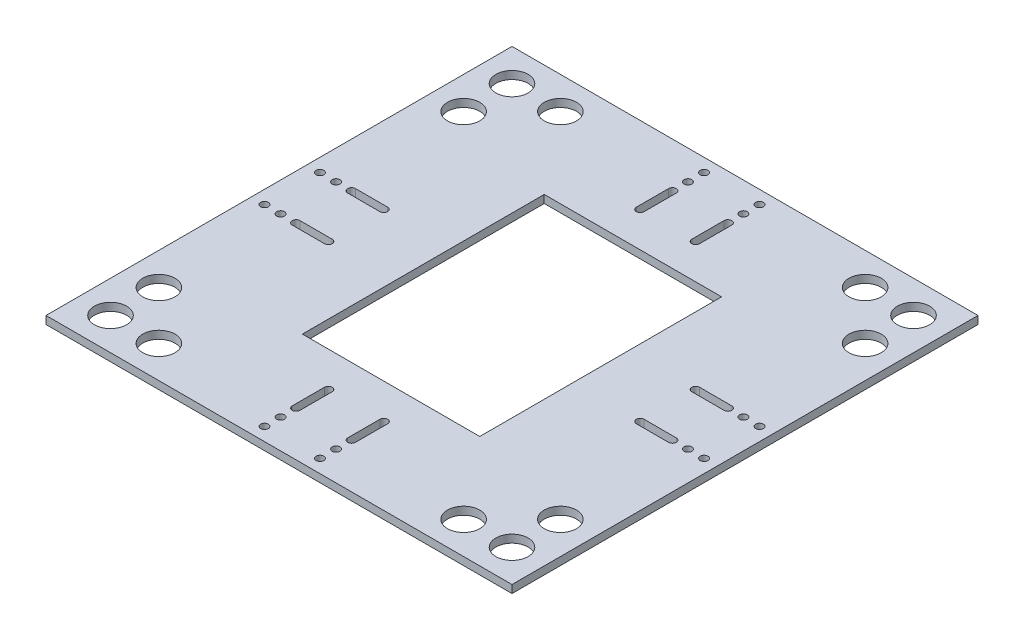
from build123d import *

# Parameters (mm, degrees)
SKETCH3_W           = 183.5200292
SKETCH3_H           = 183.5200292
BOSS_EXTRUDE1_DEPTH = 3.0988
SKETCH4_R           = 1.524
CUT_EXTRUDE1_DEPTH  = 260.555013045
CUT_EXTRUDE2_REACH  = 261.555
SKETCH5_R           = 6.35
SKETCH5_W           = 69.85
SKETCH5_H           = 95.25


with BuildPart() as part:
    # Sketch3 → Boss-Extrude1 (new body)
    with BuildSketch(Plane(origin=(0, 0, 0), x_dir=(1, 0, 0), z_dir=(0, 1, 0))):
        with Locations((91.7600146, 91.7600146)):
            Rectangle(SKETCH3_W, SKETCH3_H)
    extrude(amount=BOSS_EXTRUDE1_DEPTH)

    # Sketch4 → Cut-Extrude1 (cut, through all)
    with BuildSketch(Plane(origin=(0, 3.0988, 0), x_dir=(1, 0, 0), z_dir=(0, 1, 0))):
        with Locations((5.200015, 102.6820146)):
            Circle(SKETCH4_R)
        with Locations((11.550015, 102.6820146)):
            Circle(SKETCH4_R)
        with Locations((11.550015, 80.8380146)):
            Circle(SKETCH4_R)
        with Locations((5.200015, 80.8380146)):
            Circle(SKETCH4_R)
        with Locations((178.3200142, 80.8380146)):
            Circle(SKETCH4_R)
        with Locations((171.9700142, 80.8380146)):
            Circle(SKETCH4_R)
        with Locations((171.9700142, 102.6820146)):
            Circle(SKETCH4_R)
        with Locations((178.3200142, 102.6820146)):
            Circle(SKETCH4_R)
        with Locations((80.8380146, 178.3130292)):
            Circle(SKETCH4_R)
        with Locations((80.8380146, 171.9630292)):
            Circle(SKETCH4_R)
        with Locations((102.6820146, 171.9630292)):
            Circle(SKETCH4_R)
        with Locations((102.6820146, 178.3130292)):
            Circle(SKETCH4_R)
        with Locations((102.6820146, 5.207)):
            Circle(SKETCH4_R)
        with Locations((102.6820146, 11.557)):
            Circle(SKETCH4_R)
        with Locations((80.8380146, 11.557)):
            Circle(SKETCH4_R)
        with Locations((80.8380146, 5.207)):
            Circle(SKETCH4_R)
        with BuildLine():
            Line((17.646015, 101.1580146), (30.346015, 101.1580146))
            ThreePointArc((30.346015, 101.1580146), (31.870015, 102.6820146), (30.346015, 104.2060146))
            Line((30.346015, 104.2060146), (17.646015, 104.2060146))
            ThreePointArc((17.646015, 104.2060146), (16.122015, 102.6820146), (17.646015, 101.1580146))
        make_face()
        with BuildLine():
            Line((17.646015, 79.3140146), (30.346015, 79.3140146))
            ThreePointArc((30.346015, 79.3140146), (31.870015, 80.8380146), (30.346015, 82.3620146))
            Line((30.346015, 82.3620146), (17.646015, 82.3620146))
            ThreePointArc((17.646015, 82.3620146), (16.122015, 80.8380146), (17.646015, 79.3140146))
        make_face()
        with BuildLine():
            Line((165.8740142, 82.3620146), (153.1740142, 82.3620146))
            ThreePointArc((153.1740142, 82.3620146), (151.6500142, 80.8380146), (153.1740142, 79.3140146))
            Line((153.1740142, 79.3140146), (165.8740142, 79.3140146))
            ThreePointArc((165.8740142, 79.3140146), (167.3980142, 80.8380146), (165.8740142, 82.3620146))
        make_face()
        with BuildLine():
            Line((165.8740142, 104.2060146), (153.1740142, 104.2060146))
            ThreePointArc((153.1740142, 104.2060146), (151.6500142, 102.6820146), (153.1740142, 101.1580146))
            Line((153.1740142, 101.1580146), (165.8740142, 101.1580146))
            ThreePointArc((165.8740142, 101.1580146), (167.3980142, 102.6820146), (165.8740142, 104.2060146))
        make_face()
        with BuildLine():
            Line((79.3140146, 153.1670292), (79.3140146, 165.8670292))
            ThreePointArc((79.3140146, 165.8670292), (80.8380146, 167.3910292), (82.3620146, 165.8670292))
            Line((82.3620146, 165.8670292), (82.3620146, 153.1670292))
            ThreePointArc((82.3620146, 153.1670292), (80.8380146, 151.6430292), (79.3140146, 153.1670292))
        make_face()
        with BuildLine():
            Line((101.1580146, 153.1670292), (101.1580146, 165.8670292))
            ThreePointArc((101.1580146, 165.8670292), (102.6820146, 167.3910292), (104.2060146, 165.8670292))
            Line((104.2060146, 165.8670292), (104.2060146, 153.1670292))
            ThreePointArc((104.2060146, 153.1670292), (102.6820146, 151.6430292), (101.1580146, 153.1670292))
        make_face()
        with BuildLine():
            Line((104.2060146, 30.353), (104.2060146, 17.653))
            ThreePointArc((104.2060146, 17.653), (102.6820146, 16.129), (101.1580146, 17.653))
            Line((101.1580146, 17.653), (101.1580146, 30.353))
            ThreePointArc((101.1580146, 30.353), (102.6820146, 31.877), (104.2060146, 30.353))
        make_face()
        with BuildLine():
            Line((82.3620146, 30.353), (82.3620146, 17.653))
            ThreePointArc((82.3620146, 17.653), (80.8380146, 16.129), (79.3140146, 17.653))
            Line((79.3140146, 17.653), (79.3140146, 30.353))
            ThreePointArc((79.3140146, 30.353), (80.8380146, 31.877), (82.3620146, 30.353))
        make_face()
    extrude(amount=-CUT_EXTRUDE1_DEPTH, mode=Mode.SUBTRACT)

    # Sketch5 → Cut-Extrude2 (cut, up to next)
    with BuildSketch(Plane(origin=(0, 3.0988, 0), x_dir=(1, 0, 0), z_dir=(0, 1, 0)), mode=Mode.PRIVATE) as cut_extrude2_sk1:
        with Locations((170.8200292, 151.7700292)):
            Circle(SKETCH5_R)
    cut_extrude2_tool1 = extrude(cut_extrude2_sk1.sketch, amount=-CUT_EXTRUDE2_REACH, mode=Mode.PRIVATE) & part.part
    # Sketch5 → Cut-Extrude2 (cut, up to next)
    with BuildSketch(Plane(origin=(0, 3.0988, 0), x_dir=(1, 0, 0), z_dir=(0, 1, 0)), mode=Mode.PRIVATE) as cut_extrude2_sk2:
        with Locations((170.8200292, 170.8200292)):
            Circle(SKETCH5_R)
    cut_extrude2_tool2 = extrude(cut_extrude2_sk2.sketch, amount=-CUT_EXTRUDE2_REACH, mode=Mode.PRIVATE) & part.part
    # Sketch5 → Cut-Extrude2 (cut, up to next)
    with BuildSketch(Plane(origin=(0, 3.0988, 0), x_dir=(1, 0, 0), z_dir=(0, 1, 0)), mode=Mode.PRIVATE) as cut_extrude2_sk3:
        with Locations((151.7700292, 170.8200292)):
            Circle(SKETCH5_R)
    cut_extrude2_tool3 = extrude(cut_extrude2_sk3.sketch, amount=-CUT_EXTRUDE2_REACH, mode=Mode.PRIVATE) & part.part
    # Sketch5 → Cut-Extrude2 (cut, up to next)
    with BuildSketch(Plane(origin=(0, 3.0988, 0), x_dir=(1, 0, 0), z_dir=(0, 1, 0)), mode=Mode.PRIVATE) as cut_extrude2_sk4:
        with Locations((170.8200292, 31.75)):
            Circle(SKETCH5_R)
    cut_extrude2_tool4 = extrude(cut_extrude2_sk4.sketch, amount=-CUT_EXTRUDE2_REACH, mode=Mode.PRIVATE) & part.part
    # Sketch5 → Cut-Extrude2 (cut, up to next)
    with BuildSketch(Plane(origin=(0, 3.0988, 0), x_dir=(1, 0, 0), z_dir=(0, 1, 0)), mode=Mode.PRIVATE) as cut_extrude2_sk5:
        with Locations((12.7, 31.75)):
            Circle(SKETCH5_R)
    cut_extrude2_tool5 = extrude(cut_extrude2_sk5.sketch, amount=-CUT_EXTRUDE2_REACH, mode=Mode.PRIVATE) & part.part
    # Sketch5 → Cut-Extrude2 (cut, up to next)
    with BuildSketch(Plane(origin=(0, 3.0988, 0), x_dir=(1, 0, 0), z_dir=(0, 1, 0)), mode=Mode.PRIVATE) as cut_extrude2_sk6:
        with Locations((12.7, 12.7)):
            Circle(SKETCH5_R)
    cut_extrude2_tool6 = extrude(cut_extrude2_sk6.sketch, amount=-CUT_EXTRUDE2_REACH, mode=Mode.PRIVATE) & part.part
    # Sketch5 → Cut-Extrude2 (cut, up to next)
    with BuildSketch(Plane(origin=(0, 3.0988, 0), x_dir=(1, 0, 0), z_dir=(0, 1, 0)), mode=Mode.PRIVATE) as cut_extrude2_sk7:
        with Locations((31.75, 12.7)):
            Circle(SKETCH5_R)
    cut_extrude2_tool7 = extrude(cut_extrude2_sk7.sketch, amount=-CUT_EXTRUDE2_REACH, mode=Mode.PRIVATE) & part.part
    # Sketch5 → Cut-Extrude2 (cut, up to next)
    with BuildSketch(Plane(origin=(0, 3.0988, 0), x_dir=(1, 0, 0), z_dir=(0, 1, 0)), mode=Mode.PRIVATE) as cut_extrude2_sk8:
        with Locations((151.7700292, 12.7)):
            Circle(SKETCH5_R)
    cut_extrude2_tool8 = extrude(cut_extrude2_sk8.sketch, amount=-CUT_EXTRUDE2_REACH, mode=Mode.PRIVATE) & part.part
    # Sketch5 → Cut-Extrude2 (cut, up to next)
    with BuildSketch(Plane(origin=(0, 3.0988, 0), x_dir=(1, 0, 0), z_dir=(0, 1, 0)), mode=Mode.PRIVATE) as cut_extrude2_sk9:
        with Locations((31.75, 170.8200292)):
            Circle(SKETCH5_R)
    cut_extrude2_tool9 = extrude(cut_extrude2_sk9.sketch, amount=-CUT_EXTRUDE2_REACH, mode=Mode.PRIVATE) & part.part
    # Sketch5 → Cut-Extrude2 (cut, up to next)
    with BuildSketch(Plane(origin=(0, 3.0988, 0), x_dir=(1, 0, 0), z_dir=(0, 1, 0)), mode=Mode.PRIVATE) as cut_extrude2_sk10:
        with Locations((12.7, 170.8200292)):
            Circle(SKETCH5_R)
    cut_extrude2_tool10 = extrude(cut_extrude2_sk10.sketch, amount=-CUT_EXTRUDE2_REACH, mode=Mode.PRIVATE) & part.part
    # Sketch5 → Cut-Extrude2 (cut, up to next)
    with BuildSketch(Plane(origin=(0, 3.0988, 0), x_dir=(1, 0, 0), z_dir=(0, 1, 0)), mode=Mode.PRIVATE) as cut_extrude2_sk11:
        with Locations((12.7, 151.7700292)):
            Circle(SKETCH5_R)
    cut_extrude2_tool11 = extrude(cut_extrude2_sk11.sketch, amount=-CUT_EXTRUDE2_REACH, mode=Mode.PRIVATE) & part.part
    # Sketch5 → Cut-Extrude2 (cut, up to next)
    with BuildSketch(Plane(origin=(0, 3.0988, 0), x_dir=(1, 0, 0), z_dir=(0, 1, 0)), mode=Mode.PRIVATE) as cut_extrude2_sk12:
        with Locations((170.8200292, 12.7)):
            Circle(SKETCH5_R)
    cut_extrude2_tool12 = extrude(cut_extrude2_sk12.sketch, amount=-CUT_EXTRUDE2_REACH, mode=Mode.PRIVATE) & part.part
    # Sketch5 → Cut-Extrude2 (cut, up to next)
    with BuildSketch(Plane(origin=(0, 3.0988, 0), x_dir=(1, 0, 0), z_dir=(0, 1, 0)), mode=Mode.PRIVATE) as cut_extrude2_sk13:
        with Locations((91.7600146, 91.7600146)):
            Rectangle(SKETCH5_W, SKETCH5_H)
    cut_extrude2_tool13 = extrude(cut_extrude2_sk13.sketch, amount=-CUT_EXTRUDE2_REACH, mode=Mode.PRIVATE) & part.part
    add(cut_extrude2_tool1.solids().sort_by_distance((170.820029, 3.0988, -151.770029))[0], mode=Mode.SUBTRACT)
    add(cut_extrude2_tool2.solids().sort_by_distance((170.820029, 3.0988, -170.820029))[0], mode=Mode.SUBTRACT)
    add(cut_extrude2_tool3.solids().sort_by_distance((151.770029, 3.0988, -170.820029))[0], mode=Mode.SUBTRACT)
    add(cut_extrude2_tool4.solids().sort_by_distance((170.820029, 3.0988, -31.75))[0], mode=Mode.SUBTRACT)
    add(cut_extrude2_tool5.solids().sort_by_distance((12.7, 3.0988, -31.75))[0], mode=Mode.SUBTRACT)
    add(cut_extrude2_tool6.solids().sort_by_distance((12.7, 3.0988, -12.7))[0], mode=Mode.SUBTRACT)
    add(cut_extrude2_tool7.solids().sort_by_distance((31.75, 3.0988, -12.7))[0], mode=Mode.SUBTRACT)
    add(cut_extrude2_tool8.solids().sort_by_distance((151.770029, 3.0988, -12.7))[0], mode=Mode.SUBTRACT)
    add(cut_extrude2_tool9.solids().sort_by_distance((31.75, 3.0988, -170.820029))[0], mode=Mode.SUBTRACT)
    add(cut_extrude2_tool10.solids().sort_by_distance((12.7, 3.0988, -170.820029))[0], mode=Mode.SUBTRACT)
    add(cut_extrude2_tool11.solids().sort_by_distance((12.7, 3.0988, -151.770029))[0], mode=Mode.SUBTRACT)
    add(cut_extrude2_tool12.solids().sort_by_distance((170.820029, 3.0988, -12.7))[0], mode=Mode.SUBTRACT)
    add(cut_extrude2_tool13.solids().sort_by_distance((91.760015, 3.0988, -91.760015))[0], mode=Mode.SUBTRACT)


solid = part.part
